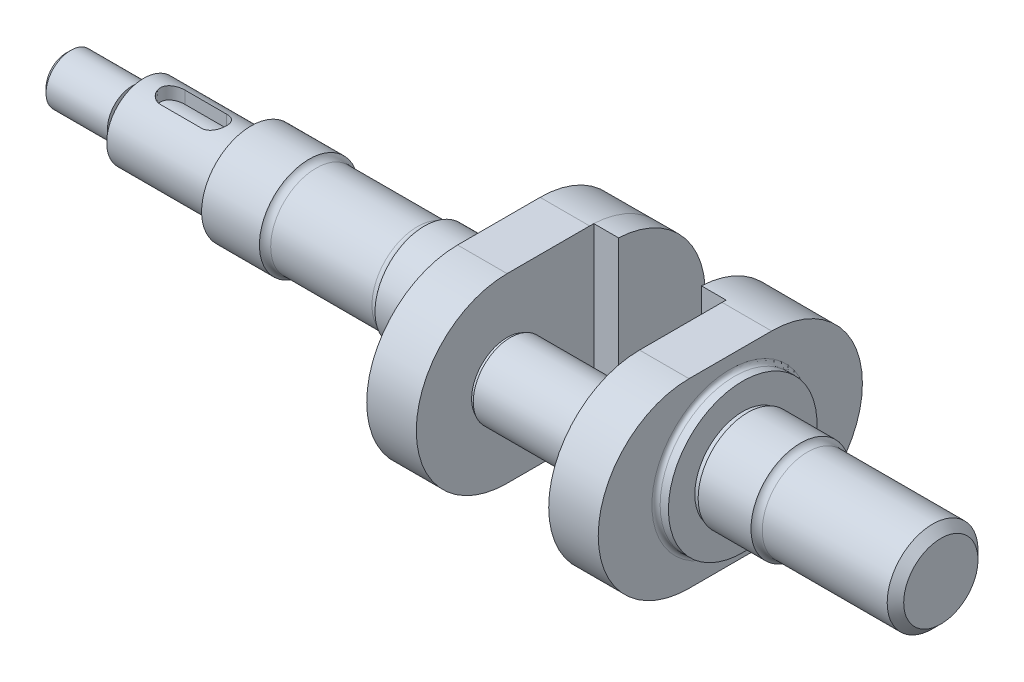
from build123d import *

# Parameters (mm, degrees)
ESTRUSIONE_ESTRUSIONE1_DEPTH    = 6
SCHIZZO3_W                      = 1.4
SCHIZZO3_H                      = 2.2
SCHIZZO3_W_2                    = 14
SCHIZZO3_H_2                    = 5.5
SCHIZZO3_W_3                    = 2
SCHIZZO3_H_3                    = 9
SCHIZZO3_W_4                    = 0.6
SCHIZZO3_H_4                    = 5.8
SMUSSO1_SIZE                    = 0.55
RACCORDO1_R                     = 0.5
RACCORDO2_R                     = 1
ESTRUSIONE_ESTRUSIONE2_DEPTH    = 3
SCHIZZO5_W                      = 0.4
SCHIZZO5_H                      = 4.3
TAGLIO_ESTRUSIONE1_REACH        = 59.382
TAGLIO_ESTRUSIONE1_START_RADIUS = 4.5
TAGLIO_ESTRUSIONE1_END_RADIUS   = 4.5
ESTRUSIONE_ESTRUSIONE3_DEPTH    = 6
ESTRUSIONE_ESTRUSIONE4_START    = 3
ESTRUSIONE_ESTRUSIONE4_DEPTH    = 3
SCHIZZO11_W                     = 1.5
SCHIZZO11_H                     = 9
SCHIZZO11_W_2                   = 0.6
SCHIZZO11_H_2                   = 5.8
SCHIZZO11_W_3                   = 17
SCHIZZO11_H_3                   = 5.5
SMUSSO3_SIZE                    = 1
RACCORDO3_R                     = 0.5
RACCORDO4_R                     = 1


with BuildPart() as part:
    # Schizzo1 → Estrusione-Estrusione1 (new body)
    with BuildSketch(Plane(origin=(0, 0, 0), x_dir=(0, 0, -1), z_dir=(1, 0, 0))):
        with BuildLine():
            Line((-5, 11), (5, 11))
            ThreePointArc((5, 11), (16, 0), (5, -11))
            Line((5, -11), (-5, -11))
            ThreePointArc((-5, -11), (-16, 0), (-5, 11))
        make_face()
    extrude(amount=ESTRUSIONE_ESTRUSIONE1_DEPTH)

    # Schizzo3 → Rivoluzione1 (revolve)
    with BuildSketch(Plane(origin=(0, 0, 0), x_dir=(1, 0, 0), z_dir=(0, 1, 0)), mode=Mode.PRIVATE) as rivoluzione1_sk:
        Polygon((-44.4, -2.2), (-44.4, 0), (-52.4, 0), (-52.4, -3), (-44.4, -3), align=None)
        Polygon((-30, -4.5), (-30, 0), (-43, 0), (-43, -2.2), (-43, -4.5), align=None)
        with Locations((-43.7, -1.1)):
            Rectangle(SCHIZZO3_W, SCHIZZO3_H)
        Polygon((-23, -5.5), (-23, 0), (-30, 0), (-30, -4.5), (-30, -6), (-23, -6), align=None)
        with Locations((-16, -2.75)):
            Rectangle(SCHIZZO3_W_2, SCHIZZO3_H_2)
        Polygon((-2.6, -5.8), (-2.6, 0), (-9, 0), (-9, -5.5), (-9, -6), (-2.6, -6), align=None)
        with Locations((-1, -4.5)):
            Rectangle(SCHIZZO3_W_3, SCHIZZO3_H_3)
        with Locations((-2.3, -2.9)):
            Rectangle(SCHIZZO3_W_4, SCHIZZO3_H_4)
    revolve(rivoluzione1_sk.sketch.rotate(Axis((-9, 0, 0), (-1, 0, 0)), 180), axis=Axis((-9, 0, 0), (-1, 0, 0)))

    # Smusso1
    smusso1_edges = [part.edges().sort_by_distance(p)[0] for p in [
        (-52.4, 0, 3),
    ]]
    chamfer(smusso1_edges, length=SMUSSO1_SIZE)

    # Raccordo1
    raccordo1_edges = [part.edges().sort_by_distance(p)[0] for p in [
        (-30, 0, 4.5),
        (0, 0, 9),
    ]]
    fillet(raccordo1_edges, radius=RACCORDO1_R)

    # Raccordo2
    # the kernel refuses this fillet: 1 mm, written as the material it adds along each edge
    with BuildSketch(Plane(origin=(-23, 0, 0), x_dir=(0, 0, -1), z_dir=(0, 1, 0))) as raccordo2_piece_1:
        with BuildLine():
            CenterArc((6.5, -0.866025404), RACCORDO2_R, 120, 60)
            Line((5.5, -0.866025404), (5.48, -0.866025404))
            Line((5.48, -0.866025404), (5.48, 0))
            Line((5.48, 0), (5.5, 0.02))
            ThreePointArc((5.5, 0.02), (5.75, 0.02), (5.99, 0.017320508))
            Line((5.99, 0.017320508), (6, 0))
        make_face()
    revolve(axis=Axis((-23, 0, 0), (-1, 0, 0)))
    with BuildSketch(Plane(origin=(-9, 0, 0), x_dir=(0, 0, -1), z_dir=(0, 1, 0))) as raccordo2_piece_2:
        with BuildLine():
            CenterArc((6.5, 0.866025404), RACCORDO2_R, 180, 60)
            Line((6, 0), (5.99, -0.017320508))
            ThreePointArc((5.99, -0.017320508), (5.75, -0.02), (5.5, -0.02))
            Line((5.5, -0.02), (5.48, 0))
            Line((5.48, 0), (5.48, 0.866025404))
            Line((5.48, 0.866025404), (5.5, 0.866025404))
        make_face()
    revolve(axis=Axis((-9, 0, 0), (-1, 0, 0)))

    # Schizzo4 → Estrusione-Estrusione2 (add)
    with BuildSketch(Plane(origin=(6, 0, 0), x_dir=(0, 0, -1), z_dir=(1, 0, 0))):
        with BuildLine():
            Line((5.5, 11), (5.5, -11))
            ThreePointArc((5.5, -11), (16, 0), (5.5, 11))
        make_face()
    extrude(amount=ESTRUSIONE_ESTRUSIONE2_DEPTH)

    # Schizzo5 → Rivoluzione2 (revolve)
    with BuildSketch(Plane(origin=(0, 0, 0), x_dir=(1, 0, 0), z_dir=(0, 1, 0))):
        Polygon((21.64, -5), (6.4, -5), (6.4, -9.3), (6.4, -9.5), (21.64, -9.5), (21.64, -9.3), (21.64, -8), align=None)
        with Locations((6.2, -7.15)):
            Rectangle(SCHIZZO5_W, SCHIZZO5_H)
        Polygon((22.04, -5), (21.64, -5), (21.64, -8), (21.64, -9.3), (22.04, -9.3), align=None)
    revolve(axis=Axis((6.4, 0, 5), (1, 0, 0)))

    # Taglio-Estrusione1: from a cylinder face, 59.382 long prism both ways, kept between that surface and its translate by the depth
    taglio_estrusione1_start = Plane(origin=(-37, 0, 0), z_dir=(1, 0, 0)) * Cylinder(TAGLIO_ESTRUSIONE1_START_RADIUS, 128.764, mode=Mode.PRIVATE)
    taglio_estrusione1_end = Plane(origin=(-37, -1.5, 0), z_dir=(1, 0, 0)) * Cylinder(TAGLIO_ESTRUSIONE1_END_RADIUS, 128.764, mode=Mode.PRIVATE)
    # Schizzo7 → Taglio-Estrusione1 (cut, from a surface)
    with BuildSketch(Plane(origin=(0, 0, 0), x_dir=(1, 0, 0), z_dir=(0, 1, 0)), mode=Mode.PRIVATE) as taglio_estrusione1_sk1:
        with BuildLine():
            Line((-39.5, 1.5), (-34.5, 1.5))
            ThreePointArc((-34.5, 1.5), (-33, 0), (-34.5, -1.5))
            Line((-34.5, -1.5), (-39.5, -1.5))
            ThreePointArc((-39.5, -1.5), (-41, 0), (-39.5, 1.5))
        make_face()
    taglio_estrusione1_tool1 = extrude(taglio_estrusione1_sk1.sketch, amount=TAGLIO_ESTRUSIONE1_REACH, both=True, mode=Mode.PRIVATE)
    add(((taglio_estrusione1_tool1 & taglio_estrusione1_start) - taglio_estrusione1_end).solids().sort_by_distance((-37, 3.492641, 0))[0], mode=Mode.SUBTRACT)

    # Schizzo8 → Estrusione-Estrusione3 (add)
    with BuildSketch(Plane(origin=(22.04, 0, 0), x_dir=(0, 0, -1), z_dir=(1, 0, 0))):
        with BuildLine():
            Line((-5, 11), (5, 11))
            ThreePointArc((5, 11), (16, 0), (5, -11))
            Line((5, -11), (-5, -11))
            ThreePointArc((-5, -11), (-16, 0), (-5, 11))
        make_face()
    extrude(amount=ESTRUSIONE_ESTRUSIONE3_DEPTH)

    # Schizzo9 → Estrusione-Estrusione4 (add)
    with BuildSketch(Plane.ZY.offset(-22.04).offset(ESTRUSIONE_ESTRUSIONE4_START)):
        with BuildLine():
            Line((-5.5, 10.988630488), (-5.5, -10.988630488))
            ThreePointArc((-5.5, -10.988630488), (-16, 0), (-5.5, 10.988630488))
        make_face()
    extrude(amount=-ESTRUSIONE_ESTRUSIONE4_DEPTH)

    # Schizzo11 → Rivoluzione3 (revolve)
    with BuildSketch(Plane(origin=(0, 0, 0), x_dir=(1, 0, 0), z_dir=(0, 1, 0))):
        with Locations((28.79, -4.5)):
            Rectangle(SCHIZZO11_W, SCHIZZO11_H)
        Polygon((36.54, 0), (30.14, 0), (30.14, -5.8), (30.14, -6), (36.54, -6), (36.54, -5.5), align=None)
        with Locations((29.84, -2.9)):
            Rectangle(SCHIZZO11_W_2, SCHIZZO11_H_2)
        with Locations((45.04, -2.75)):
            Rectangle(SCHIZZO11_W_3, SCHIZZO11_H_3)
    revolve(axis=Axis((30.14, 0, 0), (1, 0, 0)))

    # Smusso3
    smusso3_edges = [part.edges().sort_by_distance(p)[0] for p in [
        (53.54, 0, -5.5),
    ]]
    chamfer(smusso3_edges, length=SMUSSO3_SIZE)

    # Raccordo3
    raccordo3_edges = [part.edges().sort_by_distance(p)[0] for p in [
        (28.04, 0, -9),
    ]]
    fillet(raccordo3_edges, radius=RACCORDO3_R)

    # Raccordo4
    # the kernel refuses this fillet: 1 mm, written as the material it adds along each edge
    with BuildSketch(Plane(origin=(36.54, 0, 0), x_dir=(0, 0, 1), z_dir=(0, 1, 0))) as raccordo4_piece_1:
        with BuildLine():
            CenterArc((6.5, 0.866025404), RACCORDO4_R, 180, 60)
            Line((5.5, 0.866025404), (5.48, 0.866025404))
            Line((5.48, 0.866025404), (5.48, 0))
            Line((5.48, 0), (5.5, -0.02))
            ThreePointArc((5.5, -0.02), (5.75, -0.02), (5.99, -0.017320508))
            Line((5.99, -0.017320508), (6, 0))
        make_face()
    revolve(axis=Axis((36.54, 0, 0), (1, 0, 0)))


solid = part.part
